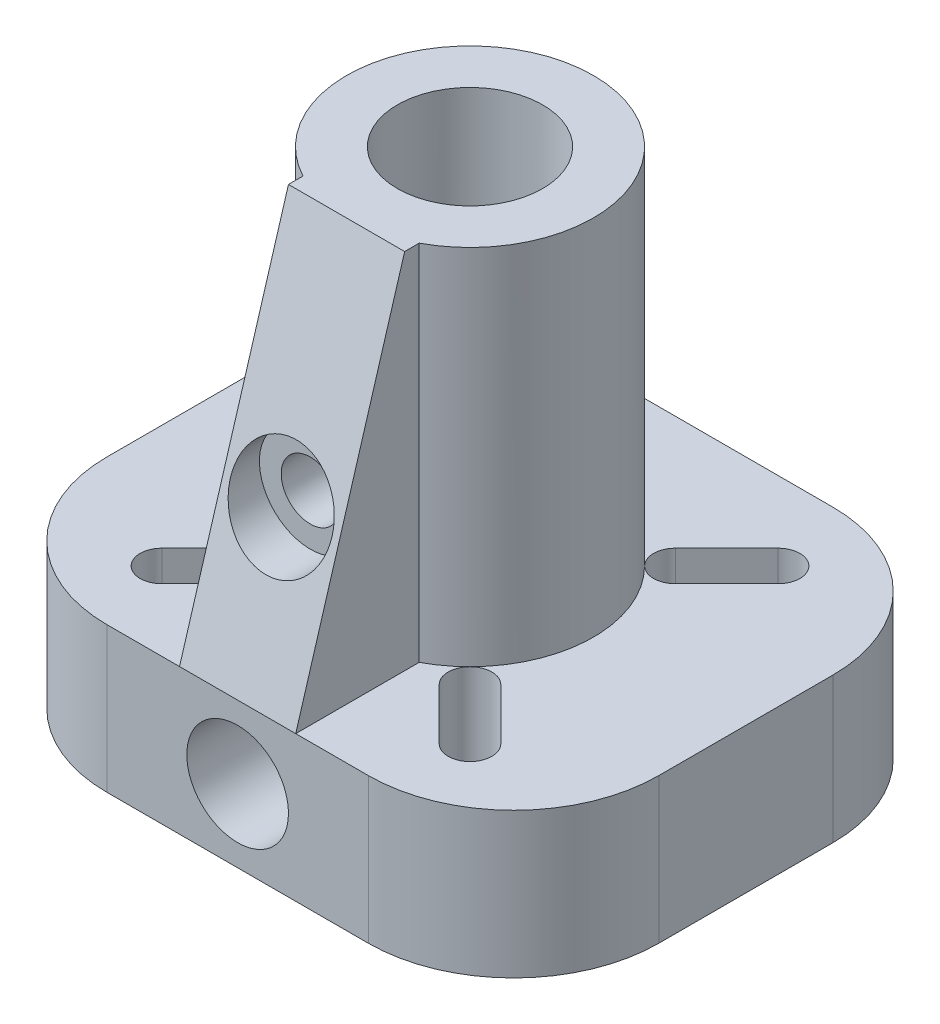
from build123d import *
from build123d.topology import SkipClean

# Parameters (mm, degrees)
SKETCH_1_R           = 5
SKETCH_1_R_2         = 1.5
EXTRUDE_2_DEPTH      = 3
CUT_EXTRUDE_START    = -37
SKETCH_2_R           = 1.5
CUT_EXTRUDE_1_DEPTH  = 37
SKETCH_3_W           = 38
SKETCH_3_H           = 6.73766493
EXTRUDE_3_DEPTH      = 3
SKETCH_5_W           = 53.60328953
SKETCH_5_H           = 19.816992683
CUT_EXTRUDE_2_DEPTH  = 3
SKETCH_6_W           = 38
SKETCH_6_H           = 40
EXTRUDE_5_DEPTH      = 7
SKETCH_8_W           = 38
SKETCH_8_H           = 8
CUT_EXTRUDE_4_DEPTH  = 44
SKETCH_9_R           = 5
CUT_EXTRUDE_5_DEPTH  = 44
CUT_EXTRUDE_6_DEPTH  = 44
SKETCH_13_R          = 8.5
EXTRUDE_6_DEPTH      = 25
SKETCH_14_R          = 3
CUT_EXTRUDE_7_DEPTH  = 25
EXTRUDE_7_DEPTH      = 4
FILLET_1_R           = 10
SKETCH_16_R          = 5
CUT_EXTRUDE_8_DEPTH  = 598
SKETCH_17_R          = 2
CUT_EXTRUDE_9_DEPTH  = 5
SKETCH_18_R          = 2
CUT_EXTRUDE_10_DEPTH = 35
SKETCH_19_R          = 3.5
CUT_EXTRUDE_11_DEPTH = 5
SKETCH_20_R          = 2
CUT_EXTRUDE_12_DEPTH = 32
SKETCH_21_R          = 3.5
CUT_EXTRUDE_13_DEPTH = 5


with BuildPart() as part:
    # 草图1 → 凸台-拉伸2 (new body)
    with BuildSketch(Plane(origin=(0, 0, 0), x_dir=(1, 0, 0), z_dir=(0, 1, 0))):
        with BuildLine():
            Line((0, 0), (19, 0))
            Line((19, 0), (19, 64))
            ThreePointArc((19, 64), (0, 66.760766922), (-19, 64))
            Line((-19, 64), (-19, 0))
            Line((-19, 0), (0, 0))
        make_face()
        with Locations((0, 40)):
            Circle(SKETCH_1_R, mode=Mode.SUBTRACT)
        with Locations((-16.171572875, 2.828427125)):
            Circle(SKETCH_1_R_2, mode=Mode.SUBTRACT)
        with Locations((-16.171572875, 61.171572875)):
            Circle(SKETCH_1_R_2, mode=Mode.SUBTRACT)
        with Locations((16.171572875, 61.171572875)):
            Circle(SKETCH_1_R_2, mode=Mode.SUBTRACT)
        with Locations((16.171572875, 2.828427125)):
            Circle(SKETCH_1_R_2, mode=Mode.SUBTRACT)
        with BuildLine():
            Line((10.606601718, 19.929208429), (10.606601718, 16.885025549))
            ThreePointArc((10.606601718, 16.885025549), (0, 16), (-10.606601718, 16.885025549))
            Line((-10.606601718, 16.885025549), (-10.606601718, 19.929208429))
            ThreePointArc((-10.606601718, 19.929208429), (0, 19), (10.606601718, 19.929208429))
        make_face(mode=Mode.SUBTRACT)
        with BuildLine():
            Line((-8.131727984, 46.01040764), (-11.66726189, 49.545941546))
            ThreePointArc((-11.66726189, 49.545941546), (-11.66726189, 51.66726189), (-9.545941546, 51.66726189))
            Line((-9.545941546, 51.66726189), (-6.01040764, 48.131727984))
            ThreePointArc((-6.01040764, 48.131727984), (-6.01040764, 46.01040764), (-8.131727984, 46.01040764))
        make_face(mode=Mode.SUBTRACT)
        with BuildLine():
            Line((6.01040764, 48.131727984), (9.545941546, 51.66726189))
            ThreePointArc((9.545941546, 51.66726189), (11.66726189, 51.66726189), (11.66726189, 49.545941546))
            Line((11.66726189, 49.545941546), (8.131727984, 46.01040764))
            ThreePointArc((8.131727984, 46.01040764), (6.01040764, 46.01040764), (6.01040764, 48.131727984))
        make_face(mode=Mode.SUBTRACT)
        with BuildLine():
            Line((8.131727984, 33.98959236), (11.66726189, 30.454058454))
            ThreePointArc((11.66726189, 30.454058454), (11.66726189, 28.33273811), (9.545941546, 28.33273811))
            Line((9.545941546, 28.33273811), (6.01040764, 31.868272016))
            ThreePointArc((6.01040764, 31.868272016), (6.01040764, 33.98959236), (8.131727984, 33.98959236))
        make_face(mode=Mode.SUBTRACT)
        with BuildLine():
            Line((-6.01040764, 31.868272016), (-9.545941546, 28.33273811))
            ThreePointArc((-9.545941546, 28.33273811), (-11.66726189, 28.33273811), (-11.66726189, 30.454058454))
            Line((-11.66726189, 30.454058454), (-8.131727984, 33.98959236))
            ThreePointArc((-8.131727984, 33.98959236), (-6.01040764, 33.98959236), (-6.01040764, 31.868272016))
        make_face(mode=Mode.SUBTRACT)
        with BuildLine():
            Line((-10.606601718, 60.070791571), (-10.606601718, 63.114974451))
            ThreePointArc((-10.606601718, 63.114974451), (0, 64), (10.606601718, 63.114974451))
            Line((10.606601718, 63.114974451), (10.606601718, 60.070791571))
            ThreePointArc((10.606601718, 60.070791571), (0, 61), (-10.606601718, 60.070791571))
        make_face(mode=Mode.SUBTRACT)
    extrude(amount=EXTRUDE_2_DEPTH)

    # 草图2 → 切除-拉伸1 (cut)
    with BuildSketch(Plane(origin=(0, 3, 0), x_dir=(1, 0, 0), z_dir=(0, 1, 0)).offset(CUT_EXTRUDE_START)):
        Polygon((0, 24), (-19, 24), (-19, 0), (19, 0), (19, 24), align=None)
        with Locations((-16.171572875, 2.828427125)):
            Circle(SKETCH_2_R, mode=Mode.SUBTRACT)
        with Locations((16.171572875, 2.828427125)):
            Circle(SKETCH_2_R, mode=Mode.SUBTRACT)
        with BuildLine():
            Line((-10.606601718, 16.885025549), (-10.606601718, 19.929208429))
            ThreePointArc((-10.606601718, 19.929208429), (0, 19), (10.606601718, 19.929208429))
            Line((10.606601718, 19.929208429), (10.606601718, 16.885025549))
            ThreePointArc((10.606601718, 16.885025549), (0, 16), (-10.606601718, 16.885025549))
        make_face(mode=Mode.SUBTRACT)
    extrude(amount=CUT_EXTRUDE_1_DEPTH, mode=Mode.SUBTRACT)

    # 草图3 → 凸台-拉伸3 (add)
    with BuildSketch(Plane.XZ):
        with Locations((0, -60.631167535)):
            Rectangle(SKETCH_3_W, SKETCH_3_H)
    extrude(amount=-EXTRUDE_3_DEPTH)

    # 草图5 → 切除-拉伸2 (cut)
    with BuildSketch(Plane(origin=(0, 3, 0), x_dir=(1, 0, 0), z_dir=(0, 1, 0))):
        with Locations((7.801644765, 73.908496342)):
            Rectangle(SKETCH_5_W, SKETCH_5_H)
    extrude(amount=-CUT_EXTRUDE_2_DEPTH, mode=Mode.SUBTRACT)

    # 草图6 → 凸台-拉伸5 (add)
    with BuildSketch(Plane(origin=(0, 3, 0), x_dir=(1, 0, 0), z_dir=(0, 1, 0))):
        with Locations((0, 44)):
            Rectangle(SKETCH_6_W, SKETCH_6_H)
    extrude(amount=EXTRUDE_5_DEPTH)

    # 草图8 → 切除-拉伸4 (cut)
    with BuildSketch(Plane(origin=(0, 0, 0), x_dir=(-1, 0, 0), z_dir=(0, -1, 0))):
        with Locations((0, 60)):
            Rectangle(SKETCH_8_W, SKETCH_8_H)
    extrude(amount=-CUT_EXTRUDE_4_DEPTH, mode=Mode.SUBTRACT)

    # 草图9 → 切除-拉伸5 (cut)
    with BuildSketch(Plane.XZ):
        with Locations((0, -40)):
            Circle(SKETCH_9_R)
    extrude(amount=-CUT_EXTRUDE_5_DEPTH, mode=Mode.SUBTRACT)

    # 草图11 → 切除-拉伸6 (cut)
    with BuildSketch(Plane.XZ):
        with BuildLine():
            Line((11.66726189, -30.454058454), (8.131727984, -33.98959236))
            ThreePointArc((8.131727984, -33.98959236), (6.01040764, -33.98959236), (6.01040764, -31.868272016))
            Line((6.01040764, -31.868272016), (9.545941546, -28.33273811))
            ThreePointArc((9.545941546, -28.33273811), (11.66726189, -28.33273811), (11.66726189, -30.454058454))
        make_face()
        with BuildLine():
            Line((9.545941546, -51.66726189), (6.01040764, -48.131727984))
            ThreePointArc((6.01040764, -48.131727984), (6.01040764, -46.01040764), (8.131727984, -46.01040764))
            Line((8.131727984, -46.01040764), (11.66726189, -49.545941546))
            ThreePointArc((11.66726189, -49.545941546), (11.66726189, -51.66726189), (9.545941546, -51.66726189))
        make_face()
        with BuildLine():
            Line((-11.66726189, -49.545941546), (-8.131727984, -46.01040764))
            ThreePointArc((-8.131727984, -46.01040764), (-6.01040764, -46.01040764), (-6.01040764, -48.131727984))
            Line((-6.01040764, -48.131727984), (-9.545941546, -51.66726189))
            ThreePointArc((-9.545941546, -51.66726189), (-11.66726189, -51.66726189), (-11.66726189, -49.545941546))
        make_face()
        with BuildLine():
            Line((-9.545941546, -28.33273811), (-6.01040764, -31.868272016))
            ThreePointArc((-6.01040764, -31.868272016), (-6.01040764, -33.98959236), (-8.131727984, -33.98959236))
            Line((-8.131727984, -33.98959236), (-11.66726189, -30.454058454))
            ThreePointArc((-11.66726189, -30.454058454), (-11.66726189, -28.33273811), (-9.545941546, -28.33273811))
        make_face()
    extrude(amount=-CUT_EXTRUDE_6_DEPTH, mode=Mode.SUBTRACT)

    # 草图13 → 凸台-拉伸6 (add)
    with SkipClean():  # the faces are left unmerged after this step: merging them gives an invalid solid
        with BuildSketch(Plane(origin=(0, 10, 0), x_dir=(1, 0, 0), z_dir=(0, 1, 0))):
            with Locations((0, 40)):
                Circle(SKETCH_13_R)
        extrude(amount=EXTRUDE_6_DEPTH)
    add(part.part.scale(1), mode=Mode.REPLACE)  # the faces are merged on a copy

    # 草图14 → 切除-拉伸7 (cut)
    with BuildSketch(Plane(origin=(0, 35, 0), x_dir=(1, 0, 0), z_dir=(0, 1, 0))):
        with Locations((0, 40)):
            Circle(SKETCH_14_R)
    extrude(amount=-CUT_EXTRUDE_7_DEPTH, mode=Mode.SUBTRACT)

    # 草图15 → 凸台-拉伸7 (add, symmetric)
    with BuildSketch(Plane(origin=(0, 0, 0), x_dir=(0, 0, -1), z_dir=(1, 0, 0))):
        Polygon((31.5, 35), (24, 10), (31.5, 10), (32.928568569, 10), (32.928568569, 35), align=None)
    extrude(amount=EXTRUDE_7_DEPTH, both=True)

    # 圆角1
    fillet_1_edges = [part.edges().sort_by_distance(p)[0] for p in [
        (19, 5, -24),
        (-19, 5, -24),
        (19, 5, -56),
        (-19, 5, -56),
    ]]
    fillet(fillet_1_edges, radius=FILLET_1_R)

    # 草图16 → 切除-拉伸8 (cut)
    with BuildSketch(Plane.XZ):
        with Locations((0, -40)):
            Circle(SKETCH_16_R)
    extrude(amount=-CUT_EXTRUDE_8_DEPTH, mode=Mode.SUBTRACT)

    # 草图17 → 切除-拉伸9 (cut)
    with BuildSketch(Plane.XZ):
        with Locations((5, -40)):
            Circle(SKETCH_17_R)
        with Locations((0, -45)):
            Circle(SKETCH_17_R)
        with Locations((-5, -40)):
            Circle(SKETCH_17_R)
        with Locations((0, -35)):
            Circle(SKETCH_17_R)
    extrude(amount=-CUT_EXTRUDE_9_DEPTH, mode=Mode.SUBTRACT)

    # 草图18 → 切除-拉伸10 (cut)
    with BuildSketch(Plane.XY.offset(-24)):
        with Locations((0, 5)):
            Circle(SKETCH_18_R)
    extrude(amount=-CUT_EXTRUDE_10_DEPTH, mode=Mode.SUBTRACT)

    # 草图19 → 切除-拉伸11 (cut)
    with BuildSketch(Plane.XY.offset(-24)):
        with Locations((0, 5)):
            Circle(SKETCH_19_R)
    extrude(amount=-CUT_EXTRUDE_11_DEPTH, mode=Mode.SUBTRACT)

    # 草图20 → 切除-拉伸12 (cut)
    with BuildSketch(Plane.XY.offset(-24)):
        with Locations((0, 20)):
            Circle(SKETCH_20_R)
    extrude(amount=-CUT_EXTRUDE_12_DEPTH, mode=Mode.SUBTRACT)

    # 草图21 → 切除-拉伸13 (cut)
    with BuildSketch(Plane.XY.offset(-24)):
        with Locations((0, 20)):
            Circle(SKETCH_21_R)
    extrude(amount=-CUT_EXTRUDE_13_DEPTH, mode=Mode.SUBTRACT)


solid = part.part
